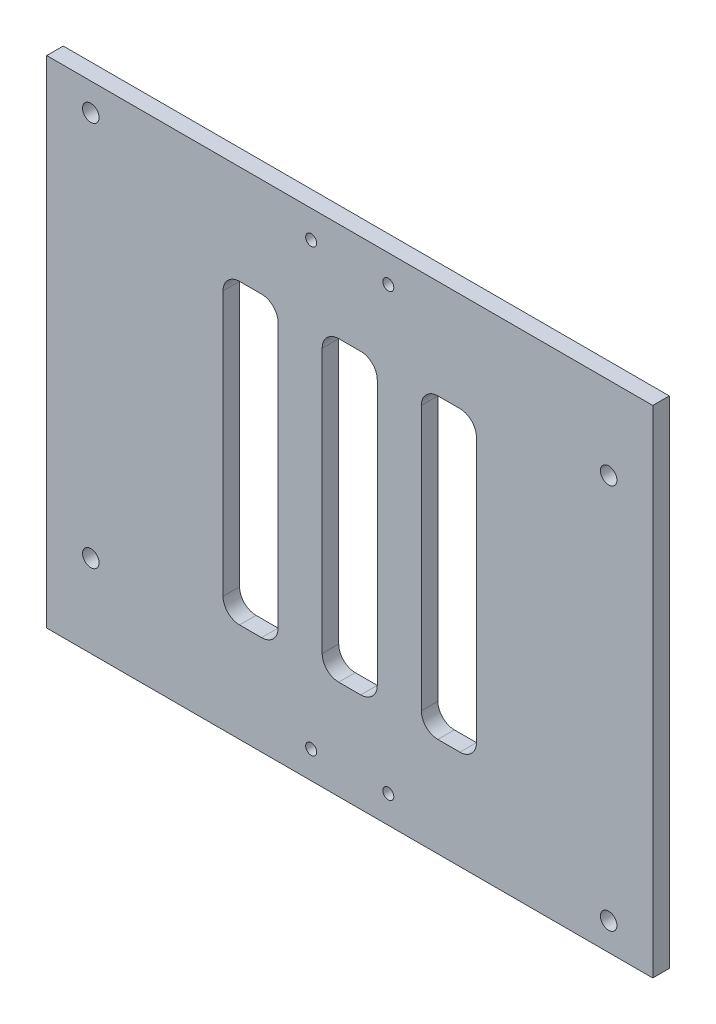
from build123d import *

# Parameters (mm, degrees)
EXTRUDE_1_OUTLINE_W = 110
EXTRUDE_1_OUTLINE_H = 90
EXTRUDE_1_DEPTH     = 3
SKETCH_2_R          = 1.5
CUT_EXTRUDE_1_DEPTH = 10
SKETCH_4_R          = 1
CUT_EXTRUDE_2_DEPTH = 10
SKETCH_5_W          = 10
SKETCH_5_H          = 54
CUT_EXTRUDE_3_DEPTH = 72.126647608
FILLET_1_R          = 3


# Read off the part's stored shape, not the designer's step: 凸台-拉伸1
with BuildPart() as part:
    # 凸台-拉伸1 outline → 凸台-拉伸1 (new body)
    with BuildSketch(Plane.XY):
        Rectangle(EXTRUDE_1_OUTLINE_W, EXTRUDE_1_OUTLINE_H)
    extrude(amount=EXTRUDE_1_DEPTH)

    # 草图2 → 切除-拉伸1 (cut)
    with BuildSketch(Plane.XY.offset(3)):
        with Locations((-47, 40)):
            Circle(SKETCH_2_R)
        with Locations((47, 30)):
            Circle(SKETCH_2_R)
        with Locations((47, -40)):
            Circle(SKETCH_2_R)
        with Locations((-47, -30)):
            Circle(SKETCH_2_R)
    extrude(amount=-CUT_EXTRUDE_1_DEPTH, mode=Mode.SUBTRACT)

    # 草图4 → 切除-拉伸2 (cut)
    with BuildSketch(Plane(origin=(0, 0, 0), x_dir=(-1, 0, 0), z_dir=(0, 0, -1))):
        with Locations((-7, 40)):
            Circle(SKETCH_4_R)
        with Locations((7, 40)):
            Circle(SKETCH_4_R)
        with Locations((-7, -40)):
            Circle(SKETCH_4_R)
        with Locations((7, -40)):
            Circle(SKETCH_4_R)
    extrude(amount=-CUT_EXTRUDE_2_DEPTH, mode=Mode.SUBTRACT)

    # 草图5 → 切除-拉伸3 (cut, through all)
    with BuildSketch(Plane.XY.offset(3)):
        with Locations((-18, 0)):
            Rectangle(SKETCH_5_W, SKETCH_5_H)
        Rectangle(SKETCH_5_W, SKETCH_5_H)
        with Locations((18, 0)):
            Rectangle(SKETCH_5_W, SKETCH_5_H)
    extrude(amount=-CUT_EXTRUDE_3_DEPTH, mode=Mode.SUBTRACT)

    # 圆角1
    fillet_1_edges = [part.edges().sort_by_distance(p)[0] for p in [
        (-23, -27, 1.5),
        (-23, 27, 1.5),
        (-13, 27, 1.5),
        (-13, -27, 1.5),
        (-5, -27, 1.5),
        (-5, 27, 1.5),
        (5, 27, 1.5),
        (5, -27, 1.5),
        (13, -27, 1.5),
        (13, 27, 1.5),
        (23, 27, 1.5),
        (23, -27, 1.5),
    ]]
    fillet(fillet_1_edges, radius=FILLET_1_R)


solid = part.part
